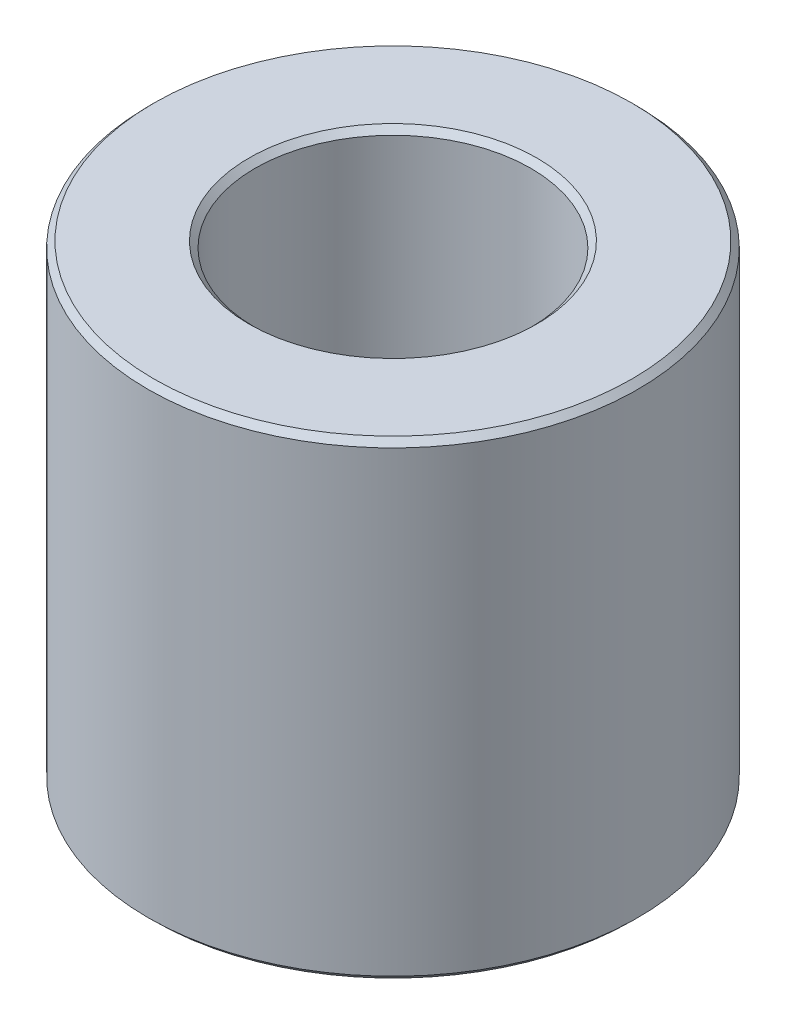
from build123d import *
from OCP.BRepFilletAPI import BRepFilletAPI_MakeChamfer

# Parameters (mm, degrees)
SKETCH1_R           = 50
BOSS_EXTRUDE1_DEPTH = 95.847833497
SKETCH2_R           = 28.148504001
CUT_EXTRUDE1_DEPTH  = 120.108384197
CHAMFER1_SIZE       = 1.234737398
CHAMFER1_SIZE2      = 1.204756392


with BuildPart() as part:
    # Sketch1 → Boss-Extrude1 (new body)
    with BuildSketch(Plane(origin=(0, 0, 0), x_dir=(1, 0, 0), z_dir=(0, 1, 0))):
        Circle(SKETCH1_R)
    extrude(amount=BOSS_EXTRUDE1_DEPTH)

    # Sketch2 → Cut-Extrude1 (cut, through all)
    with BuildSketch(Plane(origin=(0, 0, 0), x_dir=(1, 0, 0), z_dir=(0, 1, 0))):
        Circle(SKETCH2_R)
    extrude(amount=CUT_EXTRUDE1_DEPTH, mode=Mode.SUBTRACT)

    # Chamfer1: one chamfer whose edges measure the first distance from different faces: ONE call of the kernel's chamfer builder (chamfer() names one face for all edges)
    chamfer1_edges_1 = [part.edges().sort_by_distance(p)[0] for p in [
        (-28.148504001, 95.847833497, 0),
    ]]
    chamfer1_side_1 = [part.faces().sort_by_distance(p)[0] for p in [
        (-48.585786438, 95.847833497, 0),
    ]]
    chamfer1_edges_2 = [part.edges().sort_by_distance(p)[0] for p in [
        (-28.148504001, 0, 0),
    ]]
    chamfer1_side_2 = [part.faces().sort_by_distance(p)[0] for p in [
        (-28.148504001, 47.923916748, 0),
    ]]
    chamfer1_edges_3 = [part.edges().sort_by_distance(p)[0] for p in [
        (-50, 0, 0),
    ]]
    chamfer1_side_3 = [part.faces().sort_by_distance(p)[0] for p in [
        (-48.585786438, 0, 0),
    ]]
    chamfer1_edges_4 = [part.edges().sort_by_distance(p)[0] for p in [
        (-50, 95.847833497, 0),
    ]]
    chamfer1_side_4 = [part.faces().sort_by_distance(p)[0] for p in [
        (-50, 47.923916748, 0),
    ]]
    chamfer1 = BRepFilletAPI_MakeChamfer(part.part.solid().wrapped)
    for e in chamfer1_edges_1:
        chamfer1.Add(CHAMFER1_SIZE, CHAMFER1_SIZE2, e.wrapped, chamfer1_side_1[0].wrapped)  # the first distance lies on this face
    for e in chamfer1_edges_2:
        chamfer1.Add(CHAMFER1_SIZE, CHAMFER1_SIZE2, e.wrapped, chamfer1_side_2[0].wrapped)  # the first distance lies on this face
    for e in chamfer1_edges_3:
        chamfer1.Add(CHAMFER1_SIZE, CHAMFER1_SIZE2, e.wrapped, chamfer1_side_3[0].wrapped)  # the first distance lies on this face
    for e in chamfer1_edges_4:
        chamfer1.Add(CHAMFER1_SIZE, CHAMFER1_SIZE2, e.wrapped, chamfer1_side_4[0].wrapped)  # the first distance lies on this face
    add(Compound.cast(chamfer1.Shape()), mode=Mode.REPLACE)


solid = part.part
